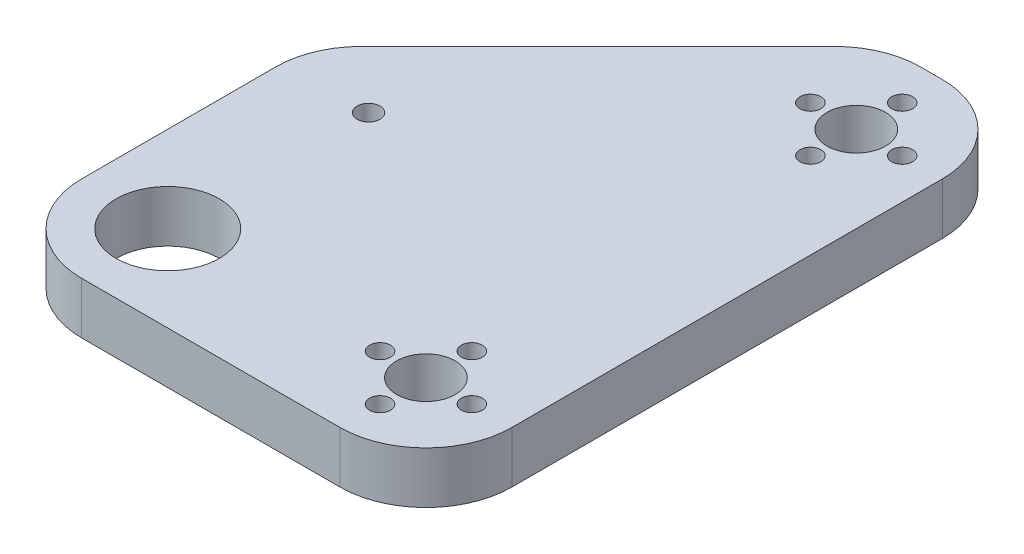
from build123d import *

# Parameters (mm, degrees)
SKETCH1_W           = 75
SKETCH1_H           = 105
BOSS_EXTRUDE1_DEPTH = 9
SKETCH2_R           = 9
SKETCH2_R_2         = 2
SKETCH2_R_3         = 5.1
SKETCH2_R_4         = 1.825
CUT_EXTRUDE1_DEPTH  = 9
CHAMFER1_SIZE       = 50
FILLET1_R           = 15


with BuildPart() as part:
    # Sketch1 → Boss-Extrude1 (new body)
    with BuildSketch(Plane(origin=(0, 0, 0), x_dir=(1, 0, 0), z_dir=(0, 1, 0))):
        with Locations((37.5, 52.5)):
            Rectangle(SKETCH1_W, SKETCH1_H)
    extrude(amount=BOSS_EXTRUDE1_DEPTH)

    # Sketch2 → Cut-Extrude1 (cut)
    with BuildSketch(Plane(origin=(0, 9, 0), x_dir=(1, 0, 0), z_dir=(0, 1, 0))):
        with Locations((15, 15)):
            Circle(SKETCH2_R)
        with Locations((15, 50)):
            Circle(SKETCH2_R_2)
        with Locations((60, 15)):
            Circle(SKETCH2_R_3)
        with Locations((60, 23)):
            Circle(SKETCH2_R_4)
        with Locations((60, 7)):
            Circle(SKETCH2_R_4)
        with Locations((68, 15)):
            Circle(SKETCH2_R_4)
        with Locations((52, 15)):
            Circle(SKETCH2_R_4)
        with Locations((60, 90)):
            Circle(SKETCH2_R_3)
        with Locations((60, 98)):
            Circle(SKETCH2_R_4)
        with Locations((60, 82)):
            Circle(SKETCH2_R_4)
        with Locations((68, 90)):
            Circle(SKETCH2_R_4)
        with Locations((52, 90)):
            Circle(SKETCH2_R_4)
    extrude(amount=-CUT_EXTRUDE1_DEPTH, mode=Mode.SUBTRACT)

    # Chamfer1
    chamfer1_edges = [part.edges().sort_by_distance(p)[0] for p in [
        (0, 4.5, -105),
    ]]
    chamfer(chamfer1_edges, length=CHAMFER1_SIZE)

    # Fillet1
    fillet1_edges = [part.edges().sort_by_distance(p)[0] for p in [
        (75, 4.5, -105),
        (50, 4.5, -105),
        (0, 4.5, -55),
        (75, 4.5, 0),
        (0, 4.5, 0),
    ]]
    fillet(fillet1_edges, radius=FILLET1_R)


solid = part.part
